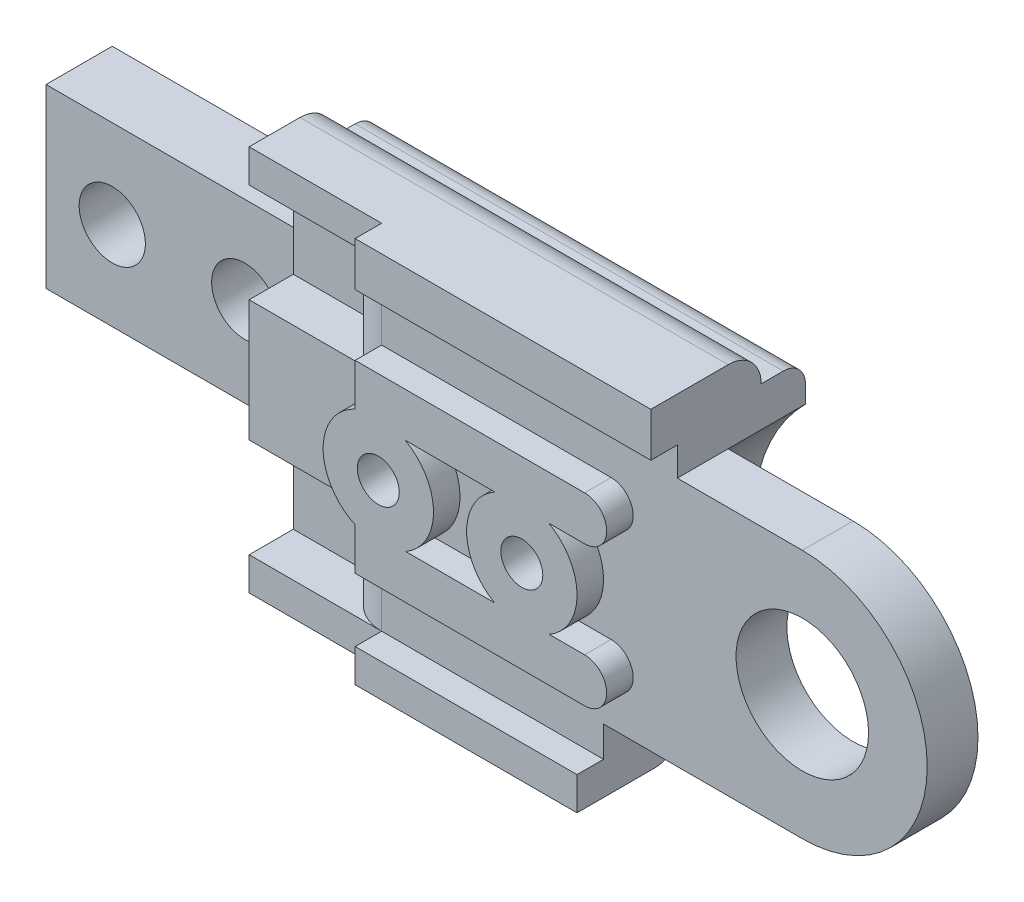
from build123d import *

# Parameters (mm, degrees)
BOSS_EXTRUDE1_DEPTH = 2
BOSS_EXTRUDE2_DEPTH = 1.5
BOSS_EXTRUDE3_DEPTH = 2.3
SKETCH6_W           = 4
SKETCH6_H           = 4.5
CUT_EXTRUDE1_DEPTH  = 2
SKETCH7_R           = 3
CUT_EXTRUDE2_DEPTH  = 3.3
SKETCH8_W           = 13.393145751
SKETCH8_H           = 2
SKETCH8_W_2         = 10.05
SKETCH8_H_2         = 1.5
BOSS_EXTRUDE4_DEPTH = 1.2
SKETCH9_R           = 2.5
BOSS_EXTRUDE5_DEPTH = 1.2
SKETCH10_R          = 0.95
CUT_EXTRUDE3_DEPTH  = 8.2
SKETCH11_R          = 2
CUT_EXTRUDE4_DEPTH  = 2.2
FILLET1_R           = 1.5
FILLET2_R           = 1
FILLET3_R           = 2
SKETCH13_W          = 3
SKETCH13_H          = 8
BOSS_EXTRUDE6_DEPTH = 12
SKETCH14_R          = 1.5
CUT_EXTRUDE5_DEPTH  = 12


with BuildPart() as part:
    # Sketch2 → Boss-Extrude1 (new body)
    with BuildSketch(Plane.XY):
        with BuildLine():
            Line((4.95, 7.456854249), (24.343145751, 7.456854249))
            Line((24.343145751, 7.456854249), (24.343145751, 5.656854249))
            ThreePointArc((24.343145751, 5.656854249), (22.60896374, 3.061467459), (22, 0))
            Line((22, 0), (21, -2.543145751))
            Line((21, -2.543145751), (21, -7.043145751))
            Line((21, -7.043145751), (8.499747468, -7.043145751))
            Line((8.499747468, -7.043145751), (4.95, -7.043145751))
            Line((4.95, -7.043145751), (4.95, 7.456854249))
        make_face()
    extrude(amount=BOSS_EXTRUDE1_DEPTH)

    # Sketch3 → Boss-Extrude2 (add)
    with BuildSketch(Plane.XY.offset(2)):
        with BuildLine():
            Line((24.343145751, 7.456854249), (24.343145751, 5.656854249))
            ThreePointArc((24.343145751, 5.656854249), (22.60896374, 3.061467459), (22, 0))
            Line((22, 0), (21, -2.543145751))
            Line((21, -2.543145751), (21, -7.043145751))
            Line((21, -7.043145751), (21, -8.543145751))
            Line((21, -8.543145751), (4.95, -8.543145751))
            Line((4.95, -8.543145751), (4.95, 8.956854249))
            Line((4.95, 8.956854249), (24.343145751, 8.956854249))
            Line((24.343145751, 8.956854249), (24.343145751, 7.456854249))
        make_face()
    extrude(amount=BOSS_EXTRUDE2_DEPTH)

    # Sketch5 → Boss-Extrude3 (add)
    with BuildSketch(Plane.XY.offset(3.5)):
        with BuildLine():
            Line((4.95, -8.543145751), (21, -8.543145751))
            Line((21, -8.543145751), (21, -5.656854249))
            Line((21, -5.656854249), (30.003145751, -5.656854249))
            ThreePointArc((30.003145751, -5.656854249), (35.66, 0), (30.003145751, 5.656854249))
            Line((30.003145751, 5.656854249), (24.343145751, 5.656854249))
            Line((24.343145751, 5.656854249), (24.343145751, 7.5))
            Line((24.343145751, 7.5), (24.343145751, 8.956854249))
            Line((24.343145751, 8.956854249), (4.95, 8.956854249))
            Line((4.95, 8.956854249), (4.95, -8.543145751))
        make_face()
    extrude(amount=BOSS_EXTRUDE3_DEPTH)

    # Sketch6 → Cut-Extrude1 (cut)
    with BuildSketch(Plane.XY.offset(5.8)):
        with Locations((6.95, 5.206854249)):
            Rectangle(SKETCH6_W, SKETCH6_H)
        with Locations((6.95, -4.793145751)):
            Rectangle(SKETCH6_W, SKETCH6_H)
    extrude(amount=-CUT_EXTRUDE1_DEPTH, mode=Mode.SUBTRACT)

    # Sketch7 → Cut-Extrude2 (cut)
    with BuildSketch(Plane.XY.offset(5.8)):
        with Locations((30.003145751, 0)):
            Circle(SKETCH7_R)
    extrude(amount=-CUT_EXTRUDE2_DEPTH, mode=Mode.SUBTRACT)

    # Sketch8 → Boss-Extrude4 (add)
    with BuildSketch(Plane.XY.offset(5.8)):
        with Locations((17.646572876, 7.956854249)):
            Rectangle(SKETCH8_W, SKETCH8_H)
        with Locations((15.975, -7.793145751)):
            Rectangle(SKETCH8_W_2, SKETCH8_H_2)
        with BuildLine():
            Line((10.95, -4.172114809), (21.343145751, -4.172114809))
            ThreePointArc((21.343145751, -4.172114809), (22.343145751, -3.172114809), (21.343145751, -2.172114809))
            Line((21.343145751, -2.172114809), (10.95, -2.172114809))
            Line((10.95, -2.172114809), (10.95, -4.172114809))
        make_face()
        with BuildLine():
            Line((21.343145751, 4.180295218), (10.95, 4.180295218))
            Line((10.95, 4.180295218), (10.95, 2.180295218))
            Line((10.95, 2.180295218), (21.343145751, 2.180295218))
            ThreePointArc((21.343145751, 2.180295218), (22.343145751, 3.180295218), (21.343145751, 4.180295218))
        make_face()
    extrude(amount=BOSS_EXTRUDE4_DEPTH)

    # Sketch9 → Boss-Extrude5 (add)
    with BuildSketch(Plane.XY.offset(5.8)):
        with Locations((18.5, 0)):
            Circle(SKETCH9_R)
        with Locations((12, 0)):
            Circle(SKETCH9_R)
    extrude(amount=BOSS_EXTRUDE5_DEPTH)

    # Sketch10 → Cut-Extrude3 (cut)
    with BuildSketch(Plane.XY.offset(7)):
        with Locations((18.5, 0)):
            Circle(SKETCH10_R)
        with Locations((12, 0)):
            Circle(SKETCH10_R)
    extrude(amount=-CUT_EXTRUDE3_DEPTH, mode=Mode.SUBTRACT)

    # Sketch11 → Cut-Extrude4 (cut)
    with BuildSketch(Plane(origin=(0, 0, 0), x_dir=(-1, 0, 0), z_dir=(0, 0, -1))):
        with Locations((-12, 0)):
            Circle(SKETCH11_R)
        with Locations((-18.5, 0)):
            Circle(SKETCH11_R)
    extrude(amount=-CUT_EXTRUDE4_DEPTH, mode=Mode.SUBTRACT)

    # Fillet1
    fillet1_edges = [part.edges().sort_by_distance(p)[0] for p in [
        (14.646572875, 8.956854249, 2),
        (12.975, -8.543145751, 2),
    ]]
    fillet(fillet1_edges, radius=FILLET1_R - 0.0001)  # a hair under: the kernel refuses the full size

    # Fillet2
    fillet2_edges = [part.edges().sort_by_distance(p)[0] for p in [
        (12.975, -7.043145751, 0),
        (14.646572875, 7.456854249, 0),
    ]]
    fillet(fillet2_edges, radius=FILLET2_R)

    # Fillet3
    fillet3_edges = [part.edges().sort_by_distance(p)[0] for p in [
        (8.95, -4.793145751, 5.8),
        (8.95, 5.206854249, 5.8),
    ]]
    fillet(fillet3_edges, radius=FILLET3_R - 0.0001)  # a hair under: the kernel refuses the full size

    # Sketch13 → Boss-Extrude6 (add)
    with BuildSketch(Plane.ZY.offset(-4.95)):
        with Locations((1.5, 0)):
            Rectangle(SKETCH13_W, SKETCH13_H)
    extrude(amount=BOSS_EXTRUDE6_DEPTH)

    # Sketch14 → Cut-Extrude5 (cut)
    with BuildSketch(Plane(origin=(0, 0, 0), x_dir=(-1, 0, 0), z_dir=(0, 0, -1))):
        with Locations((-1.95, 0)):
            Circle(SKETCH14_R)
        with Locations((4.05, 0)):
            Circle(SKETCH14_R)
    extrude(amount=-CUT_EXTRUDE5_DEPTH, mode=Mode.SUBTRACT)


solid = part.part
